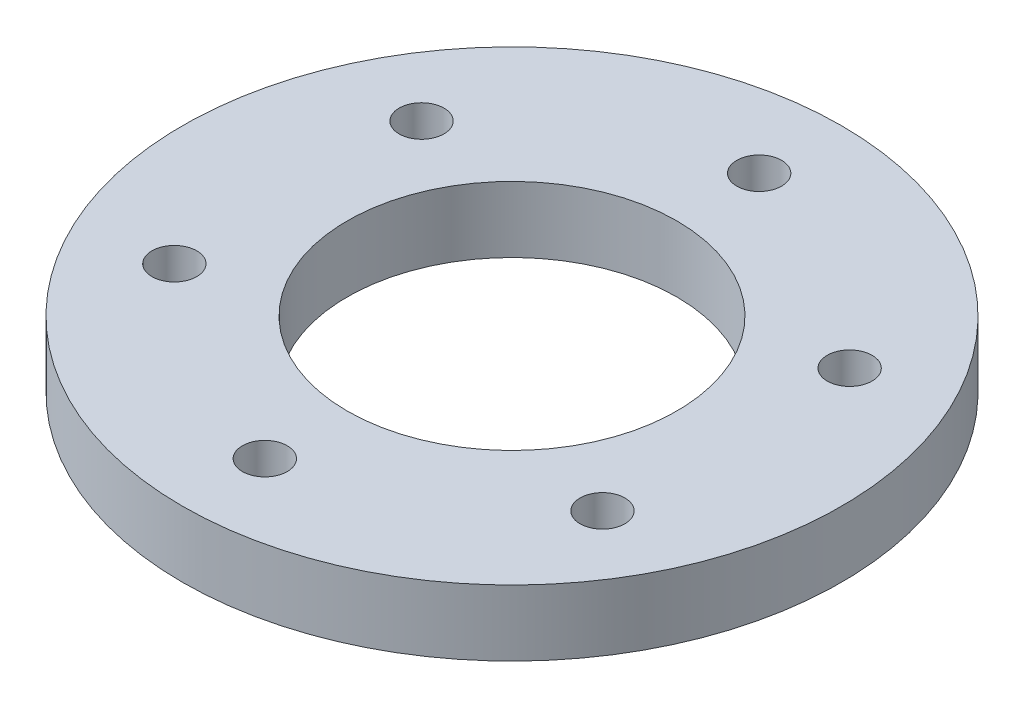
from build123d import *

# Parameters (mm, degrees)
SKETCH1_R           = 31.75
SKETCH1_R_2         = 2.159
SKETCH1_R_3         = 15.875
BOSS_EXTRUDE2_DEPTH = 6.35


with BuildPart() as part:
    # Sketch1 → Boss-Extrude2 (new body)
    with BuildSketch(Plane(origin=(0, 0, 0), x_dir=(1, 0, 0), z_dir=(0, 1, 0))):
        with Locations((16.982534111, -21.504159925)):
            Circle(SKETCH1_R)
        with Locations((-3.639695817, -33.410409925)):
            Circle(SKETCH1_R_2, mode=Mode.SUBTRACT)
        with Locations((16.982534111, -45.316659925)):
            Circle(SKETCH1_R_2, mode=Mode.SUBTRACT)
        with Locations((37.604764038, -33.410409925)):
            Circle(SKETCH1_R_2, mode=Mode.SUBTRACT)
        with Locations((-3.639695817, -9.597909925)):
            Circle(SKETCH1_R_2, mode=Mode.SUBTRACT)
        with Locations((16.982534111, 2.308340075)):
            Circle(SKETCH1_R_2, mode=Mode.SUBTRACT)
        with Locations((16.982534111, -21.504159925)):
            Circle(SKETCH1_R_3, mode=Mode.SUBTRACT)
        with Locations((37.604764038, -9.597909925)):
            Circle(SKETCH1_R_2, mode=Mode.SUBTRACT)
    extrude(amount=BOSS_EXTRUDE2_DEPTH)


solid = part.part
